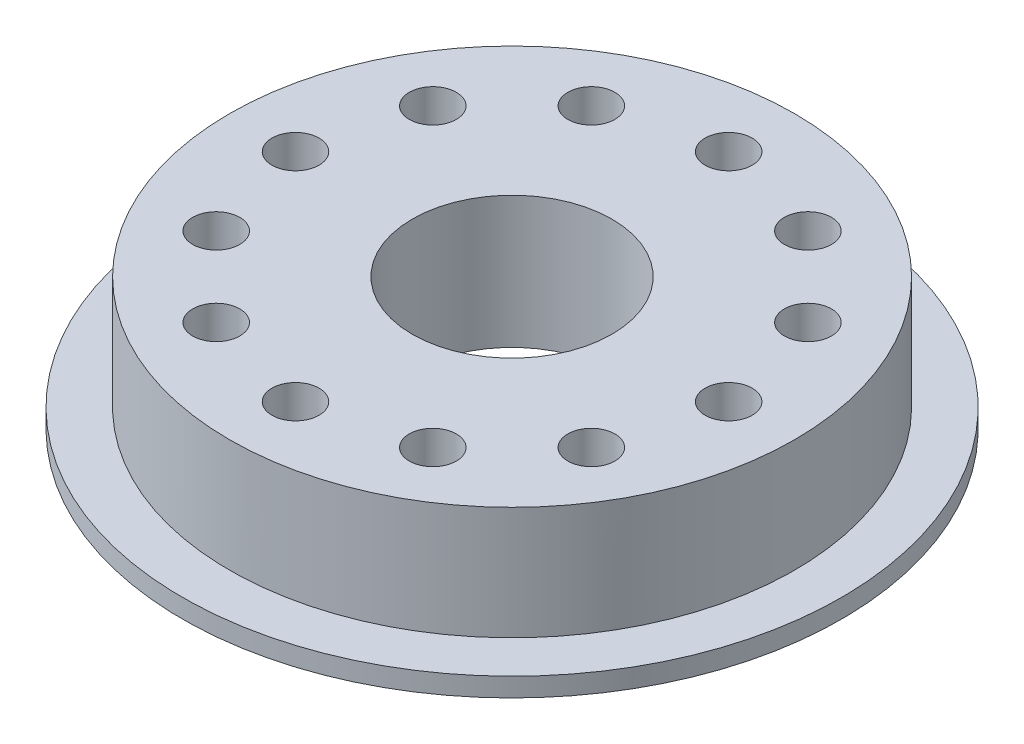
from build123d import *

# Parameters (mm, degrees)
SKETCH1_R           = 30
SKETCH1_R_2         = 10.6
BOSS_EXTRUDE1_DEPTH = 14
SKETCH2_R           = 35
BOSS_EXTRUDE2_DEPTH = 2
CUT_EXTRUDE1_START  = -64
SKETCH3_R           = 10.6
SKETCH3_R_2         = 2.5
CUT_EXTRUDE1_DEPTH  = 64


with BuildPart() as part:
    # Sketch1 → Boss-Extrude1 (new body)
    with BuildSketch(Plane(origin=(0, 0, 0), x_dir=(1, 0, 0), z_dir=(0, 1, 0))):
        Circle(SKETCH1_R)
        Circle(SKETCH1_R_2, mode=Mode.SUBTRACT)
    extrude(amount=BOSS_EXTRUDE1_DEPTH)

    # Sketch2 → Boss-Extrude2 (add)
    with BuildSketch(Plane.XZ):
        Circle(SKETCH2_R)
    extrude(amount=-BOSS_EXTRUDE2_DEPTH)

    # Sketch3 → Cut-Extrude1 (cut)
    with BuildSketch(Plane(origin=(0, 14, 0), x_dir=(1, 0, 0), z_dir=(0, 1, 0)).offset(CUT_EXTRUDE1_START)):
        Circle(SKETCH3_R)
        with Locations((0, 23)):
            Circle(SKETCH3_R_2)
        with Locations((11.5, 19.918584287)):
            Circle(SKETCH3_R_2)
        with Locations((19.918584287, 11.5)):
            Circle(SKETCH3_R_2)
        with Locations((23, 0)):
            Circle(SKETCH3_R_2)
        with Locations((19.918584287, -11.5)):
            Circle(SKETCH3_R_2)
        with Locations((11.5, -19.918584287)):
            Circle(SKETCH3_R_2)
        with Locations((0, -23)):
            Circle(SKETCH3_R_2)
        with Locations((-11.5, -19.918584287)):
            Circle(SKETCH3_R_2)
        with Locations((-19.918584287, -11.5)):
            Circle(SKETCH3_R_2)
        with Locations((-23, 0)):
            Circle(SKETCH3_R_2)
        with Locations((-19.918584287, 11.5)):
            Circle(SKETCH3_R_2)
        with Locations((-11.5, 19.918584287)):
            Circle(SKETCH3_R_2)
    extrude(amount=CUT_EXTRUDE1_DEPTH, mode=Mode.SUBTRACT)


solid = part.part
